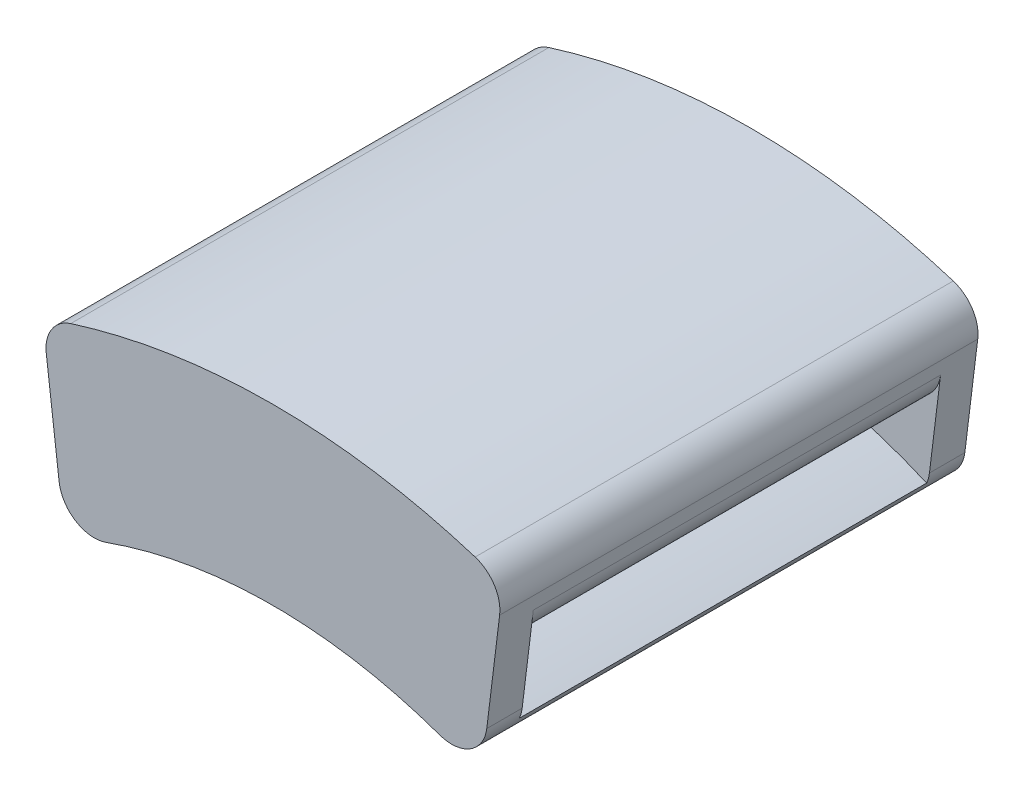
from build123d import *

# Parameters (mm, degrees)
BOSS_EXTRUDE1_DEPTH     = 23
BOSS_EXTRUDE1_2_DEPTH   = 23
CUT_EXTRUDE1_DEPTH      = 2.5
CUT_EXTRUDE1_DEPTH_BACK = 2.51
SKETCH4_R               = 10.5
BOSS_EXTRUDE4_START     = 2
BOSS_EXTRUDE4_DEPTH     = 2
BOSS_EXTRUDE5_DEPTH     = 2
FILLET2_R               = 2
SKETCH9_R               = 7.5
CUT_EXTRUDE2_DEPTH      = 29.761953613736676
FILLET3_R               = 0.9


with BuildPart() as part:
    # Sketch1 → Boss-Extrude1 (new body)
    with BuildSketch(Plane.XY):
        with BuildLine():
            Line((-13, 35.62802957704668), (-12.396640109597504, 30.72115977060107))
            ThreePointArc((-12.396640109597504, 30.72115977060107), (2.03e-15, 33.128029577046675), (12.396640109597504, 30.72115977060107))
            Line((12.396640109597504, 30.72115977060107), (13, 35.62802957704668))
            ThreePointArc((13, 35.62802957704668), (2.32e-15, 37.92567061428068), (-13, 35.62802957704668))
        make_face()
    extrude(amount=BOSS_EXTRUDE1_DEPTH)

    # Sketch4 → Cut-Extrude1 (cut, two sides: drawn at the far end of the back side and taken through both)
    with BuildSketch(Plane(origin=(0, 32.51, 0), x_dir=(1, 0, 0), z_dir=(0, 1, 0)).offset(-CUT_EXTRUDE1_DEPTH_BACK)):
        with Locations(Location((0, -11.5, 0), (0, 0, 90))):
            Circle(SKETCH4_R)
    extrude(amount=CUT_EXTRUDE1_DEPTH + CUT_EXTRUDE1_DEPTH_BACK, mode=Mode.SUBTRACT)



with BuildPart() as body_2:
    # Sketch1 → Boss-Extrude1 2 (new body)
    with BuildSketch(Plane.XY):
        with BuildLine():
            Line((11.755913778709232, 25.510404569202098), (11.999999999999998, 27.49545416973504))
            ThreePointArc((11.999999999999998, 27.49545416973504), (1.84e-15, 29.999999999999996), (-12, 27.495454169735037))
            Line((-12, 27.495454169735037), (-11.755913778709232, 25.510404569202098))
            ThreePointArc((-11.755913778709232, 25.510404569202098), (1.72e-15, 28.088827851243863), (11.755913778709232, 25.510404569202098))
        make_face()
    extrude(amount=BOSS_EXTRUDE1_2_DEPTH)


with BuildPart() as part_1:
    add(part.part)

    add(body_2.part)  # Boss-Extrude4 merges body 2
    # Sketch7 → Boss-Extrude4 (add)
    with BuildSketch(Plane(origin=(0, 0, 0), x_dir=(-1, 0, 0), z_dir=(0, 0, -1)).offset(BOSS_EXTRUDE4_START)):
        with BuildLine():
            Line((-13, 35.62802957704668), (-11.755913778709234, 25.510404569202095))
            ThreePointArc((-11.755913778709234, 25.510404569202095), (1.72e-15, 28.088827851243863), (11.755913778709232, 25.510404569202098))
            Line((11.755913778709232, 25.510404569202098), (13, 35.62802957704668))
            ThreePointArc((13, 35.62802957704668), (2.32e-15, 37.92567061428068), (-13, 35.62802957704668))
        make_face()
    extrude(amount=-BOSS_EXTRUDE4_DEPTH)

    # Sketch8 → Boss-Extrude5 (add)
    with BuildSketch(Plane.XY.offset(23)):
        with BuildLine():
            Line((-13, 35.62802957704668), (-11.755913778709232, 25.510404569202098))
            ThreePointArc((-11.755913778709232, 25.510404569202098), (1.72e-15, 28.08882785124386), (11.755913778709234, 25.510404569202095))
            Line((11.755913778709234, 25.510404569202095), (13, 35.62802957704668))
            ThreePointArc((13, 35.62802957704668), (2.32e-15, 37.92567061428068), (-13, 35.62802957704668))
        make_face()
    extrude(amount=BOSS_EXTRUDE5_DEPTH)

    # Fillet2
    # the kernel refuses this fillet: 2 mm, written as the material it takes off along each edge
    with BuildSketch(Plane(origin=(12.396640109597506, 30.72115977060107, 0), x_dir=(0.12204311064538363, 0.9925248002664713, 0), z_dir=(0, 0, 1))) as fillet2_piece_1:
        with BuildLine():
            CenterArc((2.5066448571452202, 2.0000000000000004), FILLET2_R, 169.24594081426693, 100.75405918573296)
            Line((0.541770495647174, 2.3731872767494204), (0.502473008417213, 2.3806510222844084))
            ThreePointArc((0.502473008417213, 2.3806510222844084), (0.2536935429471648, 1.1905183006056153), (-0.03864333362944333, 0.01032921904131875))
            Line((-0.03864333362944333, 0.01032921904131875), (7e-16, -0.03999999999999941))
            Line((7e-16, -0.03999999999999941), (2.5066448571452167, -0.03999999999999944))
            Line((2.5066448571452167, -0.03999999999999944), (2.506644857145216, 0))
        make_face()
    extrude(amount=23, mode=Mode.SUBTRACT)
    with BuildSketch(Plane(origin=(-12.396640109597504, 30.72115977060107, 0), x_dir=(-0.12204311064538433, 0.9925248002664712, 0), z_dir=(0, 0, 1))) as fillet2_piece_2:
        with BuildLine():
            CenterArc((2.5066448571452193, -2.0000000000000004), FILLET2_R, 90.00000000000009, 100.75405918573307)
            Line((0.5417704956471757, -2.3731872767494226), (0.5024730084172147, -2.380651022284411))
            ThreePointArc((0.5024730084172147, -2.380651022284411), (0.25369354294716395, -1.1905183006056157), (-0.03864333362944334, -0.01032921904131873))
            Line((-0.03864333362944334, -0.01032921904131873), (7.3e-16, 0.03999999999999942))
            Line((7.3e-16, 0.03999999999999942), (2.5066448571452167, 0.03999999999999944))
            Line((2.5066448571452167, 0.03999999999999944), (2.5066448571452162, -1e-17))
        make_face()
    extrude(amount=23, mode=Mode.SUBTRACT)
    with BuildSketch(Plane(origin=(-13.000000000000004, 35.62802957704668, 25), x_dir=(0.12204311064538607, -0.992524800266471, 0), z_dir=(1.3e-16, 0, -1))) as fillet2_piece_3:
        with BuildLine():
            CenterArc((1.6256056129792003, -2.000000000000001), FILLET2_R, 90.00000000000001, 79.4874561730726)
            Line((-0.34082436098006524, -1.6350984276348428), (-0.38015296045924757, -1.6278003961875385))
            ThreePointArc((-0.38015296045924757, -1.6278003961875385), (-0.2185728252516403, -0.8075104781072694), (-0.03896913386610124, 0.00902256092947678))
            Line((-0.03896913386610124, 0.00902256092947678), (-7.9e-16, 0.03999999999999942))
            Line((-7.9e-16, 0.03999999999999942), (1.6256056129791991, 0.03999999999999941))
            Line((1.6256056129791991, 0.03999999999999941), (1.6256056129791998, 1e-17))
        make_face()
    extrude(amount=27, mode=Mode.SUBTRACT)
    with BuildSketch(Plane(origin=(-11.75591377870923, 25.5104045692021, -2), x_dir=(-0.12204311064538717, 0.9925248002664707, 0), z_dir=(-7e-17, 0, 1))) as fillet2_piece_4:
        with BuildLine():
            CenterArc((2.6117659456521864, -2), FILLET2_R, 89.99999999999982, 102.58242488022142)
            Line((0.6597986854695993, -2.4356877496272804), (0.620759340265946, -2.4444015046198255))
            ThreePointArc((0.620759340265946, -2.4444015046198255), (0.3186570953348711, -1.2208892651997159), (-0.03809975642627298, -0.01218230521119634))
            Line((-0.03809975642627298, -0.01218230521119634), (8.4e-16, 0.03999999999999941))
            Line((8.4e-16, 0.03999999999999941), (2.6117659456521936, 0.0399999999999994))
            Line((2.6117659456521936, 0.0399999999999994), (2.6117659456521927, 0))
        make_face()
    extrude(amount=27, mode=Mode.SUBTRACT)
    with BuildSketch(Plane(origin=(11.755913778709234, 25.510404569202095, -2), x_dir=(0.12204311064538549, 0.9925248002664709, 0), z_dir=(0, 0, 1))) as fillet2_piece_5:
        with BuildLine():
            CenterArc((2.6117659456521967, 2), FILLET2_R, 167.41757511977872, 102.58242488022137)
            Line((0.6597986854696103, 2.435687749627282), (0.620759340265957, 2.444401504619827))
            ThreePointArc((0.620759340265957, 2.444401504619827), (0.31865709533487313, 1.2208892651997154), (-0.03809975642627296, 0.01218230521119641))
            Line((-0.03809975642627296, 0.01218230521119641), (7.7e-16, -0.03999999999999941))
            Line((7.7e-16, -0.03999999999999941), (2.6117659456522, -0.03999999999999944))
            Line((2.6117659456522, -0.03999999999999944), (2.6117659456521993, 1e-17))
        make_face()
    extrude(amount=27, mode=Mode.SUBTRACT)
    with BuildSketch(Plane(origin=(13, 35.62802957704668, 25), x_dir=(-0.12204311064538428, -0.9925248002664712, 0), z_dir=(1.3e-16, 0, -1))) as fillet2_piece_6:
        with BuildLine():
            CenterArc((1.6256056129790601, 2.000000000000001), FILLET2_R, 190.5125438269313, 79.48745617306878)
            Line((-0.3408243609801776, 1.635098427634709), (-0.3801529604593601, 1.6278003961874026))
            ThreePointArc((-0.3801529604593601, 1.6278003961874026), (-0.21857282525162663, 0.8075104781072169), (-0.03896913386610122, -0.00902256092947685))
            Line((-0.03896913386610122, -0.00902256092947685), (-7.2e-16, -0.03999999999999942))
            Line((-7.2e-16, -0.03999999999999942), (1.6256056129790626, -0.03999999999999941))
            Line((1.6256056129790626, -0.03999999999999941), (1.6256056129790633, -2e-17))
        make_face()
    extrude(amount=27, mode=Mode.SUBTRACT)

    # Sketch9 → Cut-Extrude2 (cut, through all)
    with BuildSketch(Plane(origin=(0, 32.51, 0), x_dir=(1, 0, 0), z_dir=(0, 1, 0))):
        with Locations(Location((0, -12.000000000000002, 0), (0, 0, 270))):
            Circle(SKETCH9_R)
    extrude(amount=-CUT_EXTRUDE2_DEPTH, mode=Mode.SUBTRACT)

    # Fillet3
    fillet3_edges = [part_1.edges().sort_by_distance(p)[0] for p in [
        (8.157963e-11, 28.088827851266004, 4.50000000113826),
        (8.379164e-11, 29.999999955703306, 4.499999990517632),
    ]]
    fillet(fillet3_edges, radius=FILLET3_R)


solid = part_1.part
